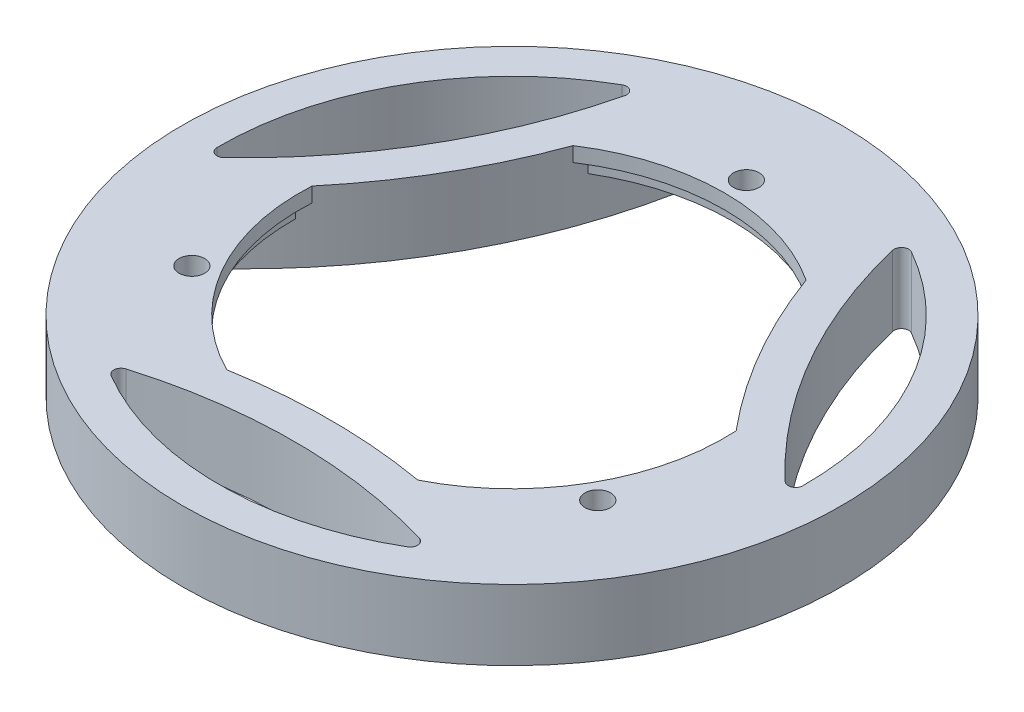
from build123d import *

# Parameters (mm, degrees)
SKETCH1_R                = 37.5
BOSS_EXTRUDE1_DEPTH      = 7.6
CUT_EXTRUDE2_START       = -7.6
CUT_EXTRUDE2_DEPTH       = 7.6
SKETCH4_R                = 45
SKETCH4_R_2              = 37.5
BOSS_EXTRUDE2_DEPTH      = 7.6
SKETCH6_R                = 45
BOSS_EXTRUDE3_DEPTH      = 2
SKETCH7_R                = 1.75
CUT_EXTRUDE3_DEPTH       = 65.359614666
CIRPATTERN2_COUNT        = 3
CUT_EXTRUDE7_DEPTH       = 65.359614666
FILLET3_R                = 1
CIRPATTERN3_COUNT        = 3
FILLET3_OF_CIRPATTERN3_R = 1
BOSS_EXTRUDE4_START      = 1.8
SKETCH15_R               = 1.75
BOSS_EXTRUDE4_DEPTH      = 1.8
CIRPATTERN4_COUNT        = 3


# Read off the part's stored shape, not the designer's step: Cut-Extrude2
with BuildPart() as part:
    # Sketch1 → Boss-Extrude1 (new body)
    with BuildSketch(Plane(origin=(0, 0, 0), x_dir=(1, 0, 0), z_dir=(0, 1, 0))):
        with Locations(Location((0, 0, 0), (0, 0, 90))):
            Circle(SKETCH1_R)
    extrude(amount=BOSS_EXTRUDE1_DEPTH)

    # Cut-Extrude2 outline → Cut-Extrude2 (cut)
    with BuildSketch(Plane(origin=(0, 7.6, 0), x_dir=(1, 0, 0), z_dir=(0, 1, 0)).offset(CUT_EXTRUDE2_START)):
        with BuildLine():
            ThreePointArc((-24.104535363, -28.726666617), (0, -24.760936498), (24.104535363, -28.726666617))
            ThreePointArc((24.104535363, -28.726666617), (32.475952642, -18.75), (36.930290738, -6.511806663))
            ThreePointArc((36.930290738, -6.511806663), (21.443600029, 12.380468249), (12.825755375, 35.238473279))
            ThreePointArc((12.825755375, 35.238473279), (0, 37.5), (-12.825755375, 35.238473279))
            ThreePointArc((-12.825755375, 35.238473279), (-21.443600029, 12.380468249), (-36.930290738, -6.511806663))
            ThreePointArc((-36.930290738, -6.511806663), (-32.475952642, -18.75), (-24.104535363, -28.726666617))
        make_face()
    extrude(amount=CUT_EXTRUDE2_DEPTH, mode=Mode.SUBTRACT)

    # Sketch4 → Boss-Extrude2 (add)
    with BuildSketch(Plane(origin=(0, 0, 0), x_dir=(1, 0, 0), z_dir=(0, 1, 0))):
        with Locations(Location((0, 0, 0), (0, 0, 90))):
            Circle(SKETCH4_R)
        Circle(SKETCH4_R_2, mode=Mode.SUBTRACT)
    extrude(amount=BOSS_EXTRUDE2_DEPTH)

    # Sketch6 → Boss-Extrude3 (add)
    with BuildSketch(Plane(origin=(0, 7.6, 0), x_dir=(1, 0, 0), z_dir=(0, 1, 0))):
        with Locations(Location((0, 0, 0), (0, 0, 90))):
            Circle(SKETCH6_R)
        with BuildLine():
            ThreePointArc((-28.952849653, 1.653026611), (-25.11473671, -14.5), (-13.044861788, -25.900416617))
            ThreePointArc((-13.044861788, -25.900416617), (0, -24.760936498), (13.044861788, -25.900416617))
            ThreePointArc((13.044861788, -25.900416617), (25.11473671, -14.5), (28.952849653, 1.653026611))
            ThreePointArc((28.952849653, 1.653026611), (21.443600029, 12.380468249), (15.907987865, 24.247390006))
            ThreePointArc((15.907987865, 24.247390006), (0, 29), (-15.907987865, 24.247390006))
            ThreePointArc((-15.907987865, 24.247390006), (-21.443600029, 12.380468249), (-28.952849653, 1.653026611))
        make_face(mode=Mode.SUBTRACT)
    extrude(amount=BOSS_EXTRUDE3_DEPTH)

    # Sketch7 → Cut-Extrude3 (cut, through all)
    with BuildSketch(Plane(origin=(0, 9.6, 0), x_dir=(1, 0, 0), z_dir=(0, 1, 0))):
        with Locations(Location((0, 32, 0), (0, 0, 270))):
            Circle(SKETCH7_R)
    cut_extrude3 = extrude(amount=-CUT_EXTRUDE3_DEPTH, mode=Mode.SUBTRACT)

    # CirPattern2: Cut-Extrude3 ×3 about axis
    cirpattern2_axis = Axis((0, 0, 0), (0, 1, 0))
    for i in range(1, CIRPATTERN2_COUNT):
        add(cut_extrude3.rotate(cirpattern2_axis, i * 360 / CIRPATTERN2_COUNT), mode=Mode.SUBTRACT)

    # Sketch13 → Cut-Extrude7 (cut, through all)
    with BuildSketch(Plane.XZ):
        with BuildLine():
            ThreePointArc((-22.11228446, 33.332369792), (0, 29.760936498), (22.11228446, 33.332369792))
            ThreePointArc((22.11228446, 33.332369792), (0, 40), (-22.11228446, 33.332369792))
        make_face()
    cut_extrude7 = extrude(amount=-CUT_EXTRUDE7_DEPTH, mode=Mode.SUBTRACT)

    # Fillet3
    fillet3_edges = [part.edges().sort_by_distance(p)[0] for p in [
        (-22.11228446, 4.8, 33.332369792),
        (22.11228446, 4.8, 33.332369792),
    ]]
    fillet(fillet3_edges, radius=FILLET3_R)

    # CirPattern3: Cut-Extrude7 ×3 about axis
    cirpattern3_axis = Axis((0, 0, 0), (0, 1, 0))
    for i in range(1, CIRPATTERN3_COUNT):
        add(cut_extrude7.rotate(cirpattern3_axis, i * 360 / CIRPATTERN3_COUNT), mode=Mode.SUBTRACT)

    # Fillet3 of CirPattern3
    fillet3_of_cirpattern3_edges = [part.edges().sort_by_distance(p)[0] for p in [
        (39.922821238, 4.8, 2.483615182),
        (17.810536778, 4.8, -35.815984974),
        (-17.810536778, 4.8, -35.815984974),
        (-39.922821238, 4.8, 2.483615182),
    ]]
    fillet(fillet3_of_cirpattern3_edges, radius=FILLET3_OF_CIRPATTERN3_R)

    # Sketch15 → Boss-Extrude4 (add)
    with BuildSketch(Plane.XZ.offset(-7.6).offset(BOSS_EXTRUDE4_START)):
        with BuildLine():
            ThreePointArc((-15.374943027, -25.760650747), (0, -30), (15.374943027, -25.760650747))
            ThreePointArc((15.374943027, -25.760650747), (13.94564115, -30.457951205), (12.825755375, -35.238473279))
            ThreePointArc((12.825755375, -35.238473279), (0, -37.5), (-12.825755375, -35.238473279))
            ThreePointArc((-12.825755375, -35.238473279), (-13.94564115, -30.457951205), (-15.374943027, -25.760650747))
        make_face()
        with Locations(Location((0, -32, 0), (0, 0, 90))):
            Circle(SKETCH15_R, mode=Mode.SUBTRACT)
    boss_extrude4 = extrude(amount=-BOSS_EXTRUDE4_DEPTH)

    # CirPattern4: Boss-Extrude4 ×3 about axis
    cirpattern4_axis = Axis((0, 7.6, 0), (0, -1, 0))
    for i in range(1, CIRPATTERN4_COUNT):
        add(boss_extrude4.rotate(cirpattern4_axis, i * 360 / CIRPATTERN4_COUNT))


solid = part.part
